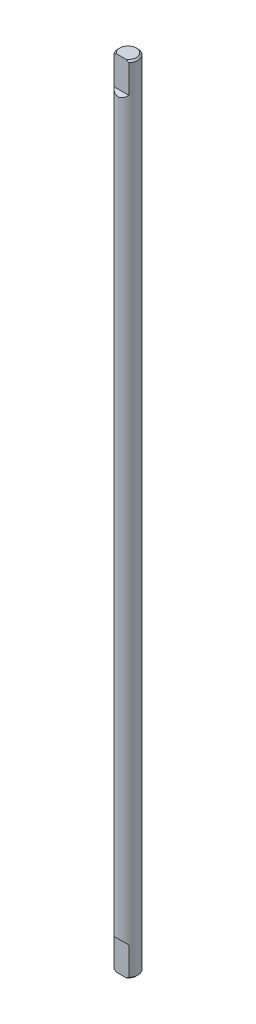
from build123d import *

# Parameters (mm, degrees)
SKIZZE1_R                       = 3
AUFSATZ_LINEAR_AUSTRAGEN1_DEPTH = 240
FASE2_SIZE                      = 0.5
SCHNITT_LINEAR_START            = 2
SKIZZE2_W                       = 6
SKIZZE2_H                       = 10
SCHNITT_LINEAR_AUSTRAGEN1_DEPTH = 239.037497071
FASE1_SIZE                      = 1


with BuildPart() as part:
    # Skizze1 → Aufsatz-Linear austragen1 (new body)
    with BuildSketch(Plane(origin=(0, 0, 0), x_dir=(1, 0, 0), z_dir=(0, 1, 0))):
        with Locations(Location((0, 0, 0), (0, 0, 270))):
            Circle(SKIZZE1_R)
    extrude(amount=AUFSATZ_LINEAR_AUSTRAGEN1_DEPTH)

    # Fase2
    fase2_edges = [part.edges().sort_by_distance(p)[0] for p in [
        (0, 0, -3),
        (0, 240, -3),
    ]]
    chamfer(fase2_edges, length=FASE2_SIZE)

    # Skizze2 → Schnitt-Linear austragen1 (cut, through all)
    with BuildSketch(Plane.XY.offset(SCHNITT_LINEAR_START)):
        with Locations((0, 235)):
            Rectangle(SKIZZE2_W, SKIZZE2_H)
        with Locations((0, 5)):
            Rectangle(SKIZZE2_W, SKIZZE2_H)
    extrude(amount=SCHNITT_LINEAR_AUSTRAGEN1_DEPTH, mode=Mode.SUBTRACT)

    # Fase1
    fase1_edges = [part.edges().sort_by_distance(p)[0] for p in [
        (0, 230, 2),
        (0, 10, 2),
    ]]
    chamfer(fase1_edges, length=FASE1_SIZE - 0.0001)  # a hair under: the kernel refuses the full size


solid = part.part
